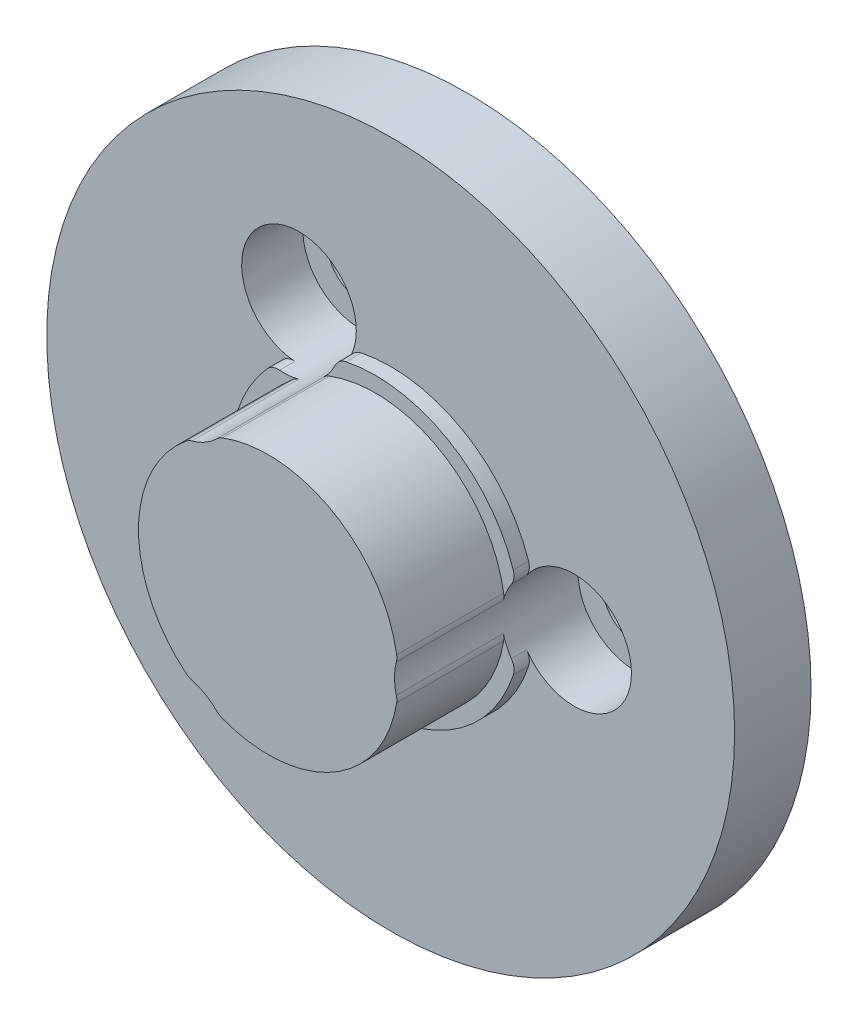
from build123d import *

# Parameters (mm, degrees)
SKETCH1_R           = 22.5
SKETCH1_R_2         = 2.15
BOSS_EXTRUDE1_DEPTH = 5
SKETCH2_R           = 3.75
CUT_EXTRUDE1_DEPTH  = 4
BOSS_EXTRUDE2_DEPTH = 1
BOSS_EXTRUDE3_DEPTH = 7
FILLET1_R           = 1


# Read off the part's stored shape, not the designer's step: Boss-Extrude2
with BuildPart() as part:
    # Sketch1 → Boss-Extrude1 (new body)
    with BuildSketch(Plane.XY.offset(31)):
        Circle(SKETCH1_R)
        with Locations((-6, 10.392304845)):
            Circle(SKETCH1_R_2, mode=Mode.SUBTRACT)
        with Locations((-6, -10.392304845)):
            Circle(SKETCH1_R_2, mode=Mode.SUBTRACT)
        with Locations((12, 0)):
            Circle(SKETCH1_R_2, mode=Mode.SUBTRACT)
    extrude(amount=BOSS_EXTRUDE1_DEPTH)

    # Sketch2 → Cut-Extrude1 (cut)
    with BuildSketch(Plane.XY.offset(36)):
        with Locations((-6, 10.392304845)):
            Circle(SKETCH2_R)
        with Locations((12, 0)):
            Circle(SKETCH2_R)
        with Locations((-6, -10.392304845)):
            Circle(SKETCH2_R)
    extrude(amount=-CUT_EXTRUDE1_DEPTH, mode=Mode.SUBTRACT)

    # Boss-Extrude2 outline → Boss-Extrude2 (add)
    with BuildSketch(Plane.XY.offset(36)):
        with BuildLine():
            ThreePointArc((9.174479167, -2.46554903), (8.25, 0), (9.174479167, 2.46554903))
            ThreePointArc((9.174479167, 2.46554903), (4.75, 8.227241336), (-2.452011489, 9.17810654))
            ThreePointArc((-2.452011489, 9.17810654), (-4.125, 7.144709581), (-6.722467678, 6.712557509))
            ThreePointArc((-6.722467678, 6.712557509), (-9.5, 0), (-6.722467678, -6.71255751))
            ThreePointArc((-6.722467678, -6.71255751), (-4.125, -7.144709581), (-2.452011489, -9.17810654))
            ThreePointArc((-2.452011489, -9.17810654), (4.75, -8.227241336), (9.174479167, -2.46554903))
        make_face()
    extrude(amount=BOSS_EXTRUDE2_DEPTH)

    # Sketch4 → Boss-Extrude3 (add)
    with BuildSketch(Plane.XY.offset(37)):
        with BuildLine():
            ThreePointArc((8.424479167, -1.130553303), (8.25, 0), (8.424479167, 1.130553303))
            ThreePointArc((8.424479167, 1.130553303), (4.25, 7.361215932), (-3.233151703, 7.861089623))
            ThreePointArc((-3.233151703, 7.861089623), (-4.125, 7.144709581), (-5.191327464, 6.730536321))
            ThreePointArc((-5.191327464, 6.730536321), (-8.5, 0), (-5.191327464, -6.730536321))
            ThreePointArc((-5.191327464, -6.730536321), (-4.125, -7.144709581), (-3.233151703, -7.861089623))
            ThreePointArc((-3.233151703, -7.861089623), (4.25, -7.361215932), (8.424479167, -1.130553303))
        make_face()
    extrude(amount=BOSS_EXTRUDE3_DEPTH)

    # Fillet1
    # the kernel refuses this fillet: 1 mm, written as the material it takes off along each edge
    with BuildSketch(Plane(origin=(9.174479167, -2.46554903, 36), x_dir=(-0.2868427193714439, -0.9579776898986714, 0), z_dir=(0, 0, 1)), Plane(origin=(-2.452011489, 9.17810654, 36), x_dir=(0.9730543753959973, 0.23057576308603095, 0), z_dir=(0, 0, 1)), Plane(origin=(-6.722467678, -6.71255751, 36), x_dir=(-0.6862116560068084, 0.7274019268330224, 0), z_dir=(0, 0, 1))) as fillet1_piece_1:
        with BuildLine():
            CenterArc((0.510994589, -0.999596963), FILLET1_R, 88.373235151, 52.473151254)
            ThreePointArc((-0.264461334, -0.368195259), (-0.126661785, -0.188097556), (0, 0))
            ThreePointArc((0, 0), (0.269691589, 0.003828853), (0.539383177, 0))
        make_face()
    extrude(amount=2.348457943, mode=Mode.SUBTRACT)
    with BuildSketch(Plane(origin=(9.174479167, 2.46554903, 36), x_dir=(-0.28684271937144556, 0.957977689898671, 0), z_dir=(0, 0, 1)), Plane(origin=(-2.452011489, -9.17810654, 36), x_dir=(0.9730543753972882, -0.23057576308058297, 0), z_dir=(0, 0, 1))) as fillet1_piece_2:
        with BuildLine():
            CenterArc((0.510994589, 0.999596963), FILLET1_R, 219.153613594, 52.473151254)
            ThreePointArc((-0.264461334, 0.368195259), (-0.126661785, 0.188097556), (0, 0))
            ThreePointArc((0, 0), (0.269691589, -0.003828853), (0.539383177, 0))
        make_face()
    extrude(amount=2.348457943, mode=Mode.SUBTRACT)
    with BuildSketch(Plane(origin=(-6.722467678, 6.712557509, 36), x_dir=(-0.686211656019457, -0.72740192682109, 0), z_dir=(0, 0, 1))) as fillet1_piece_3:
        with BuildLine():
            CenterArc((0.510994589, 0.999596963), FILLET1_R, 219.153613615, 52.473151233)
            ThreePointArc((-0.264461334, 0.368195259), (-0.126661785, 0.188097556), (0, 0))
            ThreePointArc((0, 0), (0.269691588, -0.003828853), (0.539383177, 0))
        make_face()
    extrude(amount=2.348457942, mode=Mode.SUBTRACT)
    with BuildSketch(Plane(origin=(8.424479167, -1.130553303, 37), x_dir=(-0.27697269239961747, 0.9608777901819289, 0), z_dir=(0, 0, 1)), Plane(origin=(-3.233151703, 7.861089623, 37), x_dir=(-0.6936582300297728, -0.7203042828638206, 0), z_dir=(0, 0, 1)), Plane(origin=(-5.191327464, -6.730536321, 37), x_dir=(0.9706309224297027, -0.24057350731795996, 0), z_dir=(0, 0, 1))) as fillet1_piece_4:
        with BuildLine():
            CenterArc((0.217604369, 0.999672253), FILLET1_R, 244.726311149, 23.806727181)
            ThreePointArc((-0.20933828, 0.095393549), (-0.104991878, 0.046988536), (0, 0))
            ThreePointArc((0, 0), (0.096001927, 0.001229051), (0.192003855, 0))
        make_face()
    extrude(amount=7.57512197, mode=Mode.SUBTRACT)
    with BuildSketch(Plane(origin=(8.424479167, 1.130553303, 37), x_dir=(-0.27697269239961625, -0.9608777901819292, 0), z_dir=(0, 0, 1)), Plane(origin=(-5.191327464, 6.730536321, 37), x_dir=(0.9706309224296972, 0.24057350731798183, 0), z_dir=(0, 0, 1)), Plane(origin=(-3.233151703, -7.861089623, 37), x_dir=(-0.6936582300297843, 0.7203042828638094, 0), z_dir=(0, 0, 1))) as fillet1_piece_5:
        with BuildLine():
            CenterArc((0.217604369, -0.999672253), FILLET1_R, 91.46696167, 23.806727181)
            ThreePointArc((-0.20933828, -0.095393549), (-0.104991878, -0.046988536), (0, 0))
            ThreePointArc((0, 0), (0.096001927, -0.001229051), (0.192003855, 0))
        make_face()
    extrude(amount=7.57512197, mode=Mode.SUBTRACT)


solid = part.part
